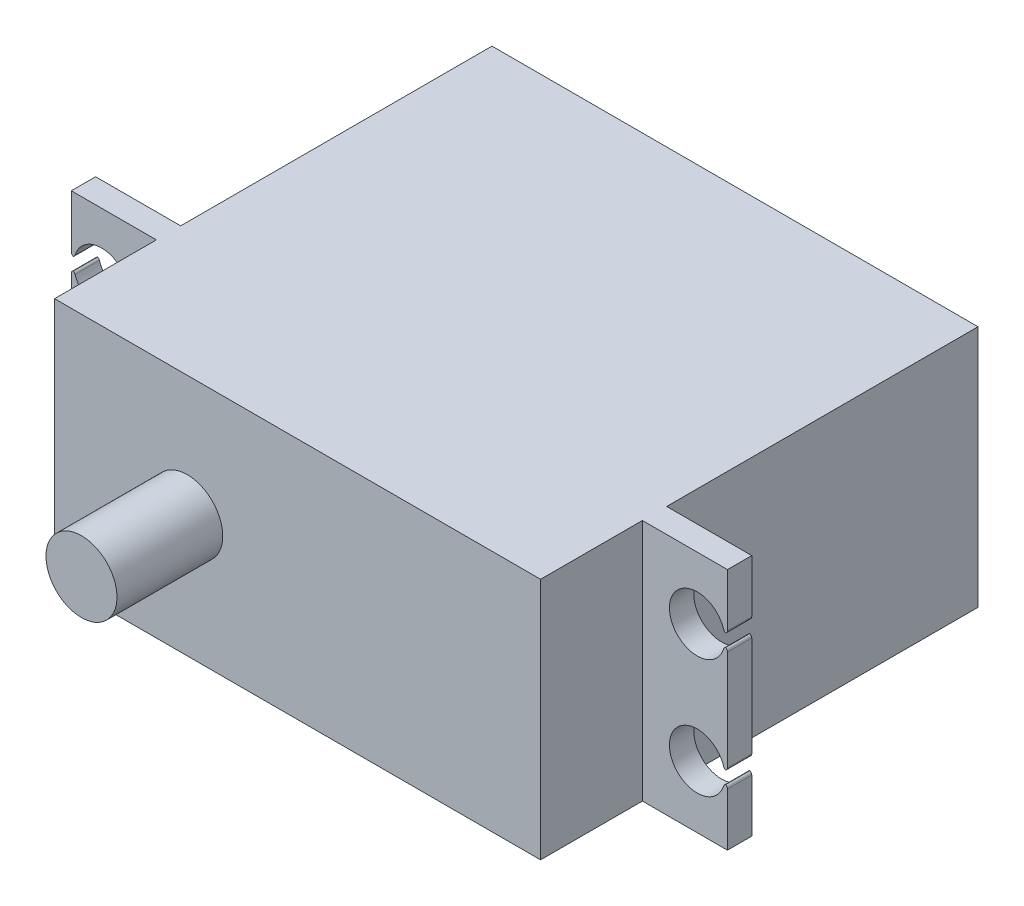
from build123d import *

# Parameters (mm, degrees)
SKETCH1_W               = 40
SKETCH1_H               = 36
BOSS_EXTRUDE1_DEPTH     = 10
BOSS_EXTRUDE2_START     = 7.62
SKETCH2_W               = 7
SKETCH2_H               = 20
BOSS_EXTRUDE2_DEPTH     = 2
CUT_EXTRUDE1_DEPTH      = 34.955853693
CUT_EXTRUDE1_DEPTH_BACK = 34.955853693
FILLET1_R               = 0.254
BOSS_EXTRUDE4_START     = 18
SKETCH5_R               = 2.921
BOSS_EXTRUDE4_DEPTH     = 8.704


with BuildPart() as part:
    # Sketch1 → Boss-Extrude1 (new, symmetric)
    with BuildSketch(Plane(origin=(0, 0, 0), x_dir=(1, 0, 0), z_dir=(0, 1, 0))):
        Rectangle(SKETCH1_W, SKETCH1_H)
    extrude(amount=BOSS_EXTRUDE1_DEPTH, both=True)

    # Sketch2 → Boss-Extrude2 (add)
    with BuildSketch(Plane.XY.offset(BOSS_EXTRUDE2_START)):
        with Locations((-23.5, 0)):
            Rectangle(SKETCH2_W, SKETCH2_H)
        with Locations((23.5, 0)):
            Rectangle(SKETCH2_W, SKETCH2_H)
    extrude(amount=BOSS_EXTRUDE2_DEPTH)

    # Sketch4 → Cut-Extrude1 (cut, two sides: drawn at the far end of the back side and taken through both)
    with BuildSketch(Plane.XY.offset(-CUT_EXTRUDE1_DEPTH_BACK)):
        with BuildLine():
            Line((-27, 5.393), (-26.739840954, 5.393))
            ThreePointArc((-26.739840954, 5.393), (-22.225, 4.885), (-26.739840954, 4.377))
            Line((-26.739840954, 4.377), (-27, 4.377))
            Line((-27, 4.377), (-27, 5.393))
        make_face()
        with BuildLine():
            Line((27, 4.377), (26.739840954, 4.377))
            ThreePointArc((26.739840954, 4.377), (22.225, 4.885), (26.739840954, 5.393))
            Line((26.739840954, 5.393), (27, 5.393))
            Line((27, 5.393), (27, 4.377))
        make_face()
        with BuildLine():
            Line((27, -5.393), (26.739840954, -5.393))
            ThreePointArc((26.739840954, -5.393), (22.225, -4.885), (26.739840954, -4.377))
            Line((26.739840954, -4.377), (27, -4.377))
            Line((27, -4.377), (27, -5.393))
        make_face()
        with BuildLine():
            Line((-27, -4.377), (-26.739840954, -4.377))
            ThreePointArc((-26.739840954, -4.377), (-22.225, -4.885), (-26.739840954, -5.393))
            Line((-26.739840954, -5.393), (-27, -5.393))
            Line((-27, -5.393), (-27, -4.377))
        make_face()
    extrude(amount=CUT_EXTRUDE1_DEPTH + CUT_EXTRUDE1_DEPTH_BACK, mode=Mode.SUBTRACT)

    # Fillet1
    # the kernel refuses this fillet: 0.254 mm, written as the material it takes off along each edge
    with BuildSketch(Plane(origin=(26.739840954, -5.393, 7.134588457), x_dir=(1, 0, 0), z_dir=(0, 0, 1)), Plane(origin=(26.739840954, 4.377, 7.134588457), x_dir=(1, 0, 0), z_dir=(0, 0, 1))) as fillet1_piece_1:
        with BuildLine():
            CenterArc((0.194164617, -0.254), FILLET1_R, 90, 72.542396876)
            ThreePointArc((-0.04813594, -0.1778), (-0.022276402, -0.089385033), (0, 0))
            Line((0, 0), (0.194164617, 0))
        make_face()
    extrude(amount=2.970823086, mode=Mode.SUBTRACT)
    with BuildSketch(Plane(origin=(27, -4.377, 10.255), x_dir=(-1, 0, 0), z_dir=(0, 0, -1)), Plane(origin=(-27, 5.393, 10.255), x_dir=(0, 1, 0), z_dir=(0, 0, -1)), Plane(origin=(27, 4.377, 10.255), x_dir=(0, -1, 0), z_dir=(0, 0, -1)), Plane(origin=(27, -5.393, 10.255), x_dir=(0, -1, 0), z_dir=(0, 0, -1))) as fillet1_piece_2:
        with BuildLine():
            CenterArc((FILLET1_R, FILLET1_R), FILLET1_R, 180, 90)
            Line((0, FILLET1_R), (0, 0))
            Line((0, 0), (FILLET1_R, 0))
        make_face()
    extrude(amount=3.27, mode=Mode.SUBTRACT)
    with BuildSketch(Plane(origin=(26.739840954, 5.393, 7.134588457), x_dir=(-0.2613232863533324, 0.9652513351503299, 0), z_dir=(0, 0, 1)), Plane(origin=(26.739840954, -4.377, 7.134588457), x_dir=(-0.26132328635333724, 0.9652513351503285, 0), z_dir=(0, 0, 1))) as fillet1_piece_3:
        with BuildLine():
            CenterArc((0.194434103, -0.253793771), FILLET1_R, 92.309007358, 72.542396876)
            Line((-0.050739736, -0.187417656), (0, 0))
            ThreePointArc((0, 0), (0.092100365, -0.001856063), (0.184200729, 0))
        make_face()
    extrude(amount=2.970823086, mode=Mode.SUBTRACT)
    with BuildSketch(Plane(origin=(-27, -5.393, 10.255), x_dir=(0, -1, 0), z_dir=(0, 0, -1)), Plane(origin=(-27, -4.377, 10.255), x_dir=(1, 0, 0), z_dir=(0, 0, -1)), Plane(origin=(-27, 4.377, 10.255), x_dir=(0, -1, 0), z_dir=(0, 0, -1)), Plane(origin=(27, 5.393, 10.255), x_dir=(0, 1, 0), z_dir=(0, 0, -1))) as fillet1_piece_4:
        with BuildLine():
            CenterArc((FILLET1_R, -FILLET1_R), FILLET1_R, 90, 90)
            Line((0, -FILLET1_R), (0, 0))
            Line((0, 0), (FILLET1_R, 0))
        make_face()
    extrude(amount=3.27, mode=Mode.SUBTRACT)
    with BuildSketch(Plane(origin=(-26.739840954, -5.393, 7.134588457), x_dir=(-1, 0, 0), z_dir=(0, 0, 1)), Plane(origin=(-26.739840954, 4.377, 7.134588457), x_dir=(-1, 0, 0), z_dir=(0, 0, 1))) as fillet1_piece_5:
        with BuildLine():
            CenterArc((0.194164617, 0.254), FILLET1_R, 197.457603124, 72.542396876)
            ThreePointArc((-0.04813594, 0.1778), (-0.022276402, 0.089385033), (0, 0))
            Line((0, 0), (0.194164617, 0))
        make_face()
    extrude(amount=2.970823086, mode=Mode.SUBTRACT)
    with BuildSketch(Plane(origin=(-26.739840954, -4.377, 7.134588457), x_dir=(0.2613232863533336, 0.9652513351503295, 0), z_dir=(0, 0, 1)), Plane(origin=(-26.739840954, 5.393, 7.134588457), x_dir=(0.2613232863533336, 0.9652513351503295, 0), z_dir=(0, 0, 1))) as fillet1_piece_6:
        with BuildLine():
            CenterArc((0.194434103, 0.253793771), FILLET1_R, 195.148595765, 72.542396876)
            Line((-0.050739736, 0.187417656), (0, 0))
            ThreePointArc((0, 0), (0.092100365, 0.001856063), (0.184200729, 0))
        make_face()
    extrude(amount=2.970823086, mode=Mode.SUBTRACT)

    # Sketch5 → Boss-Extrude4 (add)
    with BuildSketch(Plane.XY.offset(BOSS_EXTRUDE4_START)):
        with Locations(Location((-9.078, 0, 0), (0, 0, 180))):
            Circle(SKETCH5_R)
    extrude(amount=BOSS_EXTRUDE4_DEPTH)


solid = part.part
